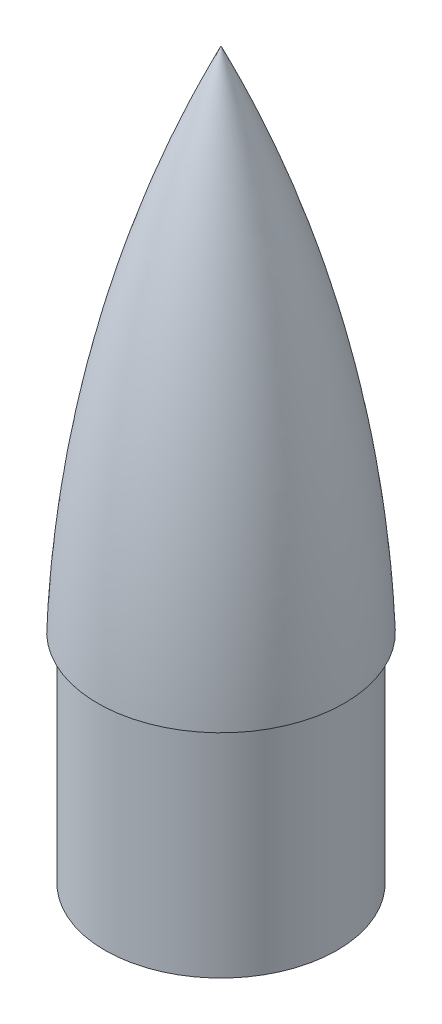
from build123d import *

# Parameters (mm, degrees)
SKETCH_1_R      = 16
SKETCH_1_R_2    = 15
EXTRUDE_1_DEPTH = 30


with BuildPart() as part:
    # Эскиз1 → Бобышка-Вытянуть1 (new body)
    with BuildSketch(Plane(origin=(0, 0, 0), x_dir=(1, 0, 0), z_dir=(0, 1, 0))):
        Circle(SKETCH_1_R)
        Circle(SKETCH_1_R_2, mode=Mode.SUBTRACT)
    extrude(amount=EXTRUDE_1_DEPTH)

    # Эскиз5 → Повернуть1 (revolve)
    with BuildSketch(Plane.XY):
        with BuildLine():
            Line((0, 30), (-17, 30))
            ThreePointArc((-17, 30), (-12.036950659, 65.858973732), (0, 100))
            Line((0, 100), (0, 30))
        make_face()
    revolve(axis=Axis((0, 100, 0), (0, -1, 0)))

    # Эскиз6 → Вырез-Повернуть1 (revolve, cut)
    with BuildSketch(Plane.XY):
        with BuildLine():
            Line((0, 98), (0, 30))
            Line((0, 30), (-14.998628482, 30))
            ThreePointArc((-14.998628482, 30), (-12.091901529, 56.079544247), (-5.383066219, 81.448486253))
            Line((-5.383066219, 81.448486253), (0, 98))
        make_face()
    revolve(axis=Axis((0, 98, 0), (0, -1, 0)), mode=Mode.SUBTRACT)


solid = part.part
